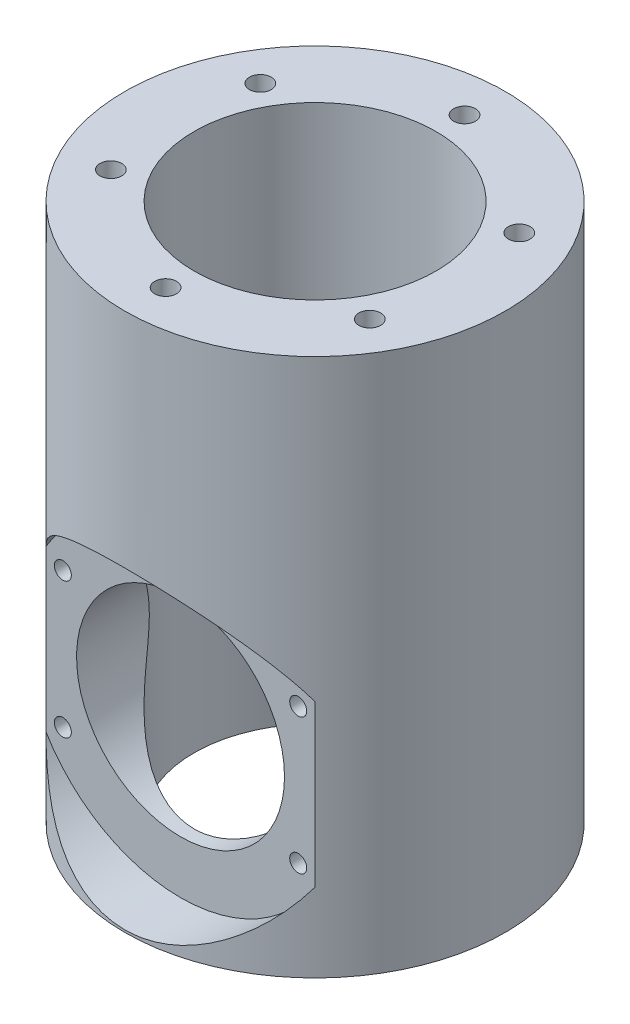
from build123d import *

# Parameters (mm, degrees)
SKETCH1_R                = 7.15
SKETCH1_R_2              = 6.65
BOSS_EXTRUDE1_DEPTH      = 5
BOSS_EXTRUDE2_DEPTH      = 27.9
BOSS_EXTRUDE2_DEPTH_BACK = 11.7
SKETCH2_R                = 14
SKETCH2_R_2              = 8.9
CUT_EXTRUDE3_DEPTH       = 7
CUT_EXTRUDE3_DEPTH_BACK  = 17
SKETCH16_R               = 6.65
CUT_EXTRUDE5_START       = -2
SKETCH23_R               = 7.05
SKETCH23_R_2             = 6.65
CUT_EXTRUDE5_DEPTH       = 2
CUT_EXTRUDE8_DEPTH       = 10
CUT_EXTRUDE8_DEPTH_BACK  = 11.28
SKETCH30_R               = 7.65
CIRPATTERN3_COUNT        = 6
BOSS_EXTRUDE3_REACH      = 49.839
BOSS_EXTRUDE3_END_RADIUS = 7.65
SKETCH39_R               = 1.816793307
CUT_EXTRUDE11_START      = 1
SKETCH38_R               = 11.53
CUT_EXTRUDE11_DEPTH      = 10
CIRPATTERN4_COUNT        = 6


with BuildPart() as part:
    # Sketch1 → Boss-Extrude1 (new body)
    with BuildSketch(Plane.XY):
        Circle(SKETCH1_R)
        Circle(SKETCH1_R_2, mode=Mode.SUBTRACT)
    extrude(amount=BOSS_EXTRUDE1_DEPTH)

    # Sketch2 → Boss-Extrude2 (add, two sides: drawn at the far end of the back side and taken through both)
    with BuildSketch(Plane(origin=(0, 0, 0), x_dir=(1, 0, 0), z_dir=(0, 1, 0)).offset(-BOSS_EXTRUDE2_DEPTH_BACK)):
        with Locations((0, 8.9)):
            Circle(SKETCH2_R)
        with Locations((0, 8.9)):
            Circle(SKETCH2_R_2, mode=Mode.SUBTRACT)
    extrude(amount=BOSS_EXTRUDE2_DEPTH + BOSS_EXTRUDE2_DEPTH_BACK)

    # Sketch16 → Cut-Extrude3 (cut, two sides: drawn at the far end of the back side and taken through both)
    with BuildSketch(Plane.XY.offset(5).offset(-CUT_EXTRUDE3_DEPTH_BACK)):
        Circle(SKETCH16_R)
    extrude(amount=CUT_EXTRUDE3_DEPTH + CUT_EXTRUDE3_DEPTH_BACK, mode=Mode.SUBTRACT)

    # Sketch23 → Cut-Extrude5 (cut)
    with BuildSketch(Plane.XY.offset(5).offset(CUT_EXTRUDE5_START)):
        Circle(SKETCH23_R)
        Circle(SKETCH23_R_2, mode=Mode.SUBTRACT)
    extrude(amount=CUT_EXTRUDE5_DEPTH, mode=Mode.SUBTRACT)

    # Sketch30 → Cut-Extrude8 (cut, two sides: drawn at the far end of the back side and taken through both)
    with BuildSketch(Plane.XY.offset(5).offset(-CUT_EXTRUDE8_DEPTH_BACK)):
        Circle(SKETCH30_R)
    extrude(amount=CUT_EXTRUDE8_DEPTH + CUT_EXTRUDE8_DEPTH_BACK, mode=Mode.SUBTRACT)

    # Sketch47 → Tap Drill for M2 Tap1 (revolve, cut)
    with BuildSketch(Plane(origin=(0, 27.9, 2.1), x_dir=(0, 0, 1), z_dir=(1, 0, 0))):
        Polygon((0, 0), (0, 4.480688495), (0.8, 4), (0.8, 0), align=None)
    tap_drill_for_m2_tap1 = revolve(axis=Axis((0, 34.25, 2.1), (0, -1, 0)), mode=Mode.SUBTRACT)

    # CirPattern3: Tap Drill for M2 Tap1 ×6 about axis
    cirpattern3_axis = Axis((0, -11.7, -8.9), (0, 1, 0))
    for i in range(1, CIRPATTERN3_COUNT):
        add(tap_drill_for_m2_tap1.rotate(cirpattern3_axis, i * 360 / CIRPATTERN3_COUNT), mode=Mode.SUBTRACT)

    # Mirror1 copy 1 sketch → Mirror1 copy 1 (revolve, cut)
    with BuildSketch(Plane(origin=(9.526279442, -11.7, -3.4), x_dir=(0.8660254037844386, 0, 0.5000000000000001), z_dir=(0.5000000000000001, 0, -0.8660254037844386))):
        Polygon((0, 0), (0, -4.480688495), (0.8, -4), (0.8, 0), align=None)
    revolve(axis=Axis((9.526279442, -18.05, -3.4), (0, -1, 0)), mode=Mode.SUBTRACT)

    # Mirror1 copy 2 sketch → Mirror1 copy 2 (revolve, cut)
    with BuildSketch(Plane(origin=(9.526279442, -11.7, -14.4), x_dir=(0.8660254037844387, 0, -0.4999999999999998), z_dir=(-0.4999999999999998, 0, -0.8660254037844387))):
        Polygon((0, 0), (0, -4.480688495), (0.8, -4), (0.8, 0), align=None)
    revolve(axis=Axis((9.526279442, -18.05, -14.4), (0, -1, 0)), mode=Mode.SUBTRACT)

    # Mirror1 copy 3 sketch → Mirror1 copy 3 (revolve, cut)
    with BuildSketch(Plane(origin=(0, -11.7, -19.9), x_dir=(0, 0, -1), z_dir=(-1, 0, 0))):
        Polygon((0, 0), (0, -4.480688495), (0.8, -4), (0.8, 0), align=None)
    revolve(axis=Axis((0, -18.05, -19.9), (0, -1, 0)), mode=Mode.SUBTRACT)

    # Mirror1 copy 4 sketch → Mirror1 copy 4 (revolve, cut)
    with BuildSketch(Plane(origin=(-9.526279442, -11.7, -14.4), x_dir=(-0.8660254037844384, 0, -0.5000000000000004), z_dir=(-0.5000000000000004, 0, 0.8660254037844384))):
        Polygon((0, 0), (0, -4.480688495), (0.8, -4), (0.8, 0), align=None)
    revolve(axis=Axis((-9.526279442, -18.05, -14.4), (0, -1, 0)), mode=Mode.SUBTRACT)

    # Mirror1 copy 5 sketch → Mirror1 copy 5 (revolve, cut)
    with BuildSketch(Plane(origin=(-9.526279442, -11.7, -3.4), x_dir=(-0.8660254037844386, 0, 0.5000000000000001), z_dir=(0.5000000000000001, 0, 0.8660254037844386))):
        Polygon((0, 0), (0, -4.480688495), (0.8, -4), (0.8, 0), align=None)
    revolve(axis=Axis((-9.526279442, -18.05, -3.4), (0, -1, 0)), mode=Mode.SUBTRACT)

    # Mirror1 copy 6 sketch → Mirror1 copy 6 (revolve, cut)
    with BuildSketch(Plane(origin=(0, -11.7, 2.1), x_dir=(0, 0, 1), z_dir=(1, 0, 0))):
        Polygon((0, 0), (0, -4.480688495), (0.8, -4), (0.8, 0), align=None)
    revolve(axis=Axis((0, -18.05, 2.1), (0, -1, 0)), mode=Mode.SUBTRACT)

    # Boss-Extrude3: up to this cylinder (the profile starts outside it)
    boss_extrude3_end = Plane(origin=(0, 0, 2.1), z_dir=(0, 0, -1)) * Cylinder(BOSS_EXTRUDE3_END_RADIUS, 115.978, mode=Mode.PRIVATE)
    # Sketch39 → Boss-Extrude3 (add, up to the surface)
    with BuildSketch(Plane.XZ.offset(11.7), mode=Mode.PRIVATE) as boss_extrude3_sk1:
        with Locations((0, 2.1)):
            Circle(SKETCH39_R)
    boss_extrude3_tool1 = extrude(boss_extrude3_sk1.sketch, amount=-BOSS_EXTRUDE3_REACH, mode=Mode.PRIVATE) - boss_extrude3_end
    add(boss_extrude3_tool1.solids().sort_by_distance((0, -11.7, 2.1))[0])

    # Sketch38 → Cut-Extrude11 (cut)
    with BuildSketch(Plane.XY.offset(CUT_EXTRUDE11_START)):
        Circle(SKETCH38_R)
    extrude(amount=CUT_EXTRUDE11_DEPTH, mode=Mode.SUBTRACT)

    # Sketch49 → Tap Drill for M1.6 Tap1 (revolve, cut)
    with BuildSketch(Plane(origin=(-8.660254038, 5, 1), x_dir=(0, -1, 0), z_dir=(1, 0, 0))):
        Polygon((0, 0), (0, 5.375537887), (0.625, 5), (0.625, 0), align=None)
    tap_drill_for_m1_6_tap1 = revolve(axis=Axis((-8.660254038, 5, 7.35), (0, 0, -1)), mode=Mode.SUBTRACT)

    # CirPattern4: Tap Drill for M1.6 Tap1 ×6 about axis, 2 skipped
    cirpattern4_axis = Axis((0, 0, 15), (0, 0, 1))
    add([tap_drill_for_m1_6_tap1.rotate(cirpattern4_axis, i * 360 / CIRPATTERN4_COUNT) for i in range(1, CIRPATTERN4_COUNT) if i not in (2, 5)], mode=Mode.SUBTRACT)


solid = part.part
